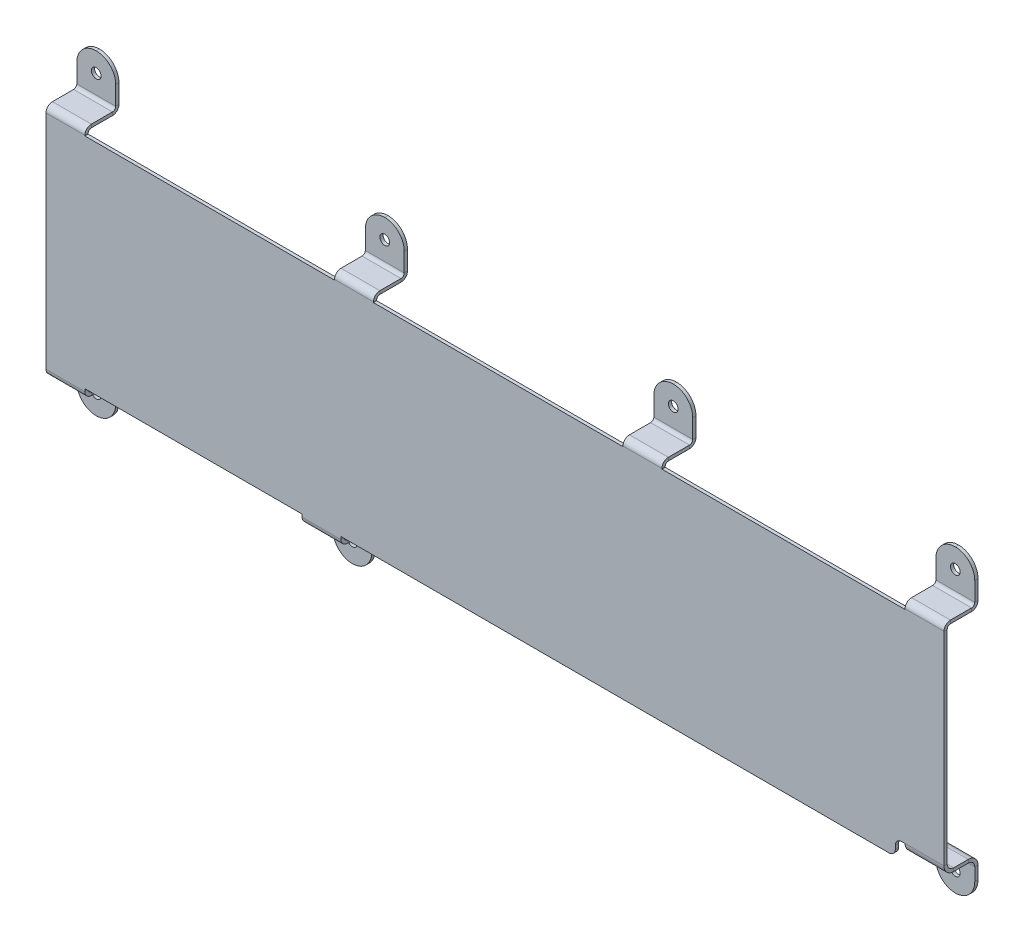
from build123d import *

# Parameters (mm, degrees)
SKETCH1_W          = 277
SKETCH1_H          = 97.5
BASE_FLANGE1_DEPTH = 1
JOG1_START         = -138.5
JOG1_DEPTH         = 277
JOG1_2_DEPTH       = 277
JOG2_START         = -138.5
JOG2_DEPTH         = 277
JOG2_2_DEPTH       = 277
SKETCH11_W         = 67
SKETCH11_H         = 15
SKETCH11_W_2       = 75
SKETCH11_W_3       = 77
CUT_EXTRUDE1_DEPTH = 148.204152455
SKETCH16_W         = 12
SKETCH16_H         = 22.35
TAB1_DEPTH         = 1
JOG4_START         = 126.5
JOG4_DEPTH         = 12
JOG4_2_DEPTH       = 12
SKETCH22_R         = 1.5
SCREW_HOLES_DEPTH  = 148.204152455
FILLET1_R          = 6
FILLET2_R          = 2


# Read off the part's stored shape, not the designer's step: Jog1, Jog2, Jog4
# Sheet-metal steps are written as plain solids
with BuildPart() as part:
    # Sketch1 → Base-Flange1 (new body)
    with BuildSketch(Plane.XY):
        Rectangle(SKETCH1_W, SKETCH1_H)
    extrude(amount=-BASE_FLANGE1_DEPTH)

    # Jog1 outline → Jog1 (cut)
    with BuildSketch(Plane.YZ.offset(JOG1_START)):
        with BuildLine():
            ThreePointArc((36.928097245, -1), (35.928097245, -0.732050807), (35.196046438, 0))
            Line((35.196046438, 0), (-48.75, 0))
            Line((-48.75, 0), (-48.75, -1))
            Line((-48.75, -1), (36.928097245, -1))
        make_face()
    extrude(amount=JOG1_DEPTH, mode=Mode.SUBTRACT)

    # Jog1 2 outline → Jog1 2 (add)
    with BuildSketch(Plane.YZ.offset(JOG1_START)):
        with BuildLine():
            Line((34.928097245, 7.5), (34.928097245, 1))
            ThreePointArc((34.928097245, 1), (34.996245593, 0.48236191), (35.196046438, 0))
            Line((35.196046438, 0), (36.928097245, 0))
            ThreePointArc((36.928097245, 0), (36.220990464, 0.292893219), (35.928097245, 1))
            Line((35.928097245, 1), (35.928097245, 7.5))
            ThreePointArc((35.928097245, 7.5), (35.342310807, 8.914213562), (33.928097245, 9.5))
            Line((33.928097245, 9.5), (-48.75, 9.5))
            Line((-48.75, 9.5), (-48.75, 8.5))
            Line((-48.75, 8.5), (33.928097245, 8.5))
            ThreePointArc((33.928097245, 8.5), (34.635204026, 8.207106781), (34.928097245, 7.5))
        make_face()
    extrude(amount=JOG1_2_DEPTH)

    # Jog2 outline → Jog2 (cut)
    with BuildSketch(Plane.YZ.offset(JOG2_START)):
        with BuildLine():
            Line((-48.75, 8.5), (-36.303953562, 8.5))
            ThreePointArc((-36.303953562, 8.5), (-35.571902755, 9.232050807), (-34.571902755, 9.5))
            Line((-34.571902755, 9.5), (-48.75, 9.5))
            Line((-48.75, 9.5), (-48.75, 8.5))
        make_face()
    extrude(amount=JOG2_DEPTH, mode=Mode.SUBTRACT)

    # Jog2 2 outline → Jog2 2 (add)
    with BuildSketch(Plane.YZ.offset(JOG2_START)):
        with BuildLine():
            Line((-48.75, -1), (-37.571902755, -1))
            ThreePointArc((-37.571902755, -1), (-36.157689193, -0.414213562), (-35.571902755, 1))
            Line((-35.571902755, 1), (-35.571902755, 7.5))
            ThreePointArc((-35.571902755, 7.5), (-35.279009536, 8.207106781), (-34.571902755, 8.5))
            Line((-34.571902755, 8.5), (-36.303953562, 8.5))
            ThreePointArc((-36.303953562, 8.5), (-36.503754407, 8.01763809), (-36.571902755, 7.5))
            Line((-36.571902755, 7.5), (-36.571902755, 1))
            ThreePointArc((-36.571902755, 1), (-36.864795974, 0.292893219), (-37.571902755, 0))
            Line((-37.571902755, 0), (-48.75, 0))
            Line((-48.75, 0), (-48.75, -1))
        make_face()
    extrude(amount=JOG2_2_DEPTH)

    # Sketch11 → Cut-Extrude1 (cut, through all)
    with BuildSketch(Plane(origin=(0, 0, -1), x_dir=(-1, 0, 0), z_dir=(0, 0, -1))):
        Polygon((-138.5, -48.75), (-123.5, -48.75), (-111.5, -48.75), (47.5, -48.75), (47.5, -33.75), (-111.5, -33.75), (-123.5, -33.75), (-123.5, -28.75), (-138.5, -28.75), align=None)
        with Locations((93, -41.25)):
            Rectangle(SKETCH11_W, SKETCH11_H)
        with Locations((-89, 41.25)):
            Rectangle(SKETCH11_W_2, SKETCH11_H)
        with Locations((-1, 41.25)):
            Rectangle(SKETCH11_W_3, SKETCH11_H)
        with Locations((88, 41.25)):
            Rectangle(SKETCH11_W_3, SKETCH11_H)
    extrude(amount=-CUT_EXTRUDE1_DEPTH, mode=Mode.SUBTRACT)

    # Sketch16 → Tab1 (add)
    with BuildSketch(Plane(origin=(0, 0, 8.5), x_dir=(-1, 0, 0), z_dir=(0, 0, -1))):
        with Locations((-132.5, -39.925)):
            Rectangle(SKETCH16_W, SKETCH16_H)
    extrude(amount=-TAB1_DEPTH)

    # Jog4 outline → Jog4 (cut)
    with BuildSketch(Plane.YZ.offset(JOG4_START)):
        with BuildLine():
            Line((-51.1, 8.5), (-30.986067978, 8.5))
            ThreePointArc((-30.986067978, 8.5), (-29.974744872, 9.238612788), (-28.75, 9.5))
            Line((-28.75, 9.5), (-51.1, 9.5))
            Line((-51.1, 9.5), (-51.1, 8.5))
        make_face()
    extrude(amount=JOG4_DEPTH, mode=Mode.SUBTRACT)

    # Jog4 2 outline → Jog4 2 (add)
    with BuildSketch(Plane.YZ.offset(JOG4_START)):
        with BuildLine():
            Line((-43.746018366, -1), (-33.75, -1))
            ThreePointArc((-33.75, -1), (-31.628679656, -0.121320344), (-30.75, 2))
            Line((-30.75, 2), (-30.75, 6.5))
            ThreePointArc((-30.75, 6.5), (-30.164213562, 7.914213562), (-28.75, 8.5))
            Line((-28.75, 8.5), (-30.986067978, 8.5))
            ThreePointArc((-30.986067978, 8.5), (-31.552517077, 7.570466269), (-31.75, 6.5))
            Line((-31.75, 6.5), (-31.75, 2))
            ThreePointArc((-31.75, 2), (-32.335786438, 0.585786438), (-33.75, 0))
            Line((-33.75, 0), (-43.746018366, 0))
            Line((-43.746018366, 0), (-43.746018366, -1))
        make_face()
    extrude(amount=JOG4_2_DEPTH)

    # Sketch22 → SCREW HOLES (cut, through all)
    with BuildSketch(Plane(origin=(0, 0, -1), x_dir=(-1, 0, 0), z_dir=(0, 0, -1))):
        with Locations((132.5, 42.75)):
            Circle(SKETCH22_R)
        with Locations((132.5, -42.75)):
            Circle(SKETCH22_R)
        with Locations((43.5, 42.75)):
            Circle(SKETCH22_R)
        with Locations((53.5, -42.75)):
            Circle(SKETCH22_R)
        with Locations((-45.5, 42.75)):
            Circle(SKETCH22_R)
        with Locations((-132.5, 42.75)):
            Circle(SKETCH22_R)
        with Locations((-132.5, -37.75)):
            Circle(SKETCH22_R)
    extrude(amount=-SCREW_HOLES_DEPTH, mode=Mode.SUBTRACT)

    # Fillet1
    fillet1_edges = [part.edges().sort_by_distance(p)[0] for p in [
        (39.5, 48.75, -0.5),
        (51.5, 48.75, -0.5),
        (-49.5, 48.75, -0.5),
        (-37.5, 48.75, -0.5),
        (-126.5, 48.75, -0.5),
        (-138.5, 48.75, -0.5),
        (-138.5, -48.75, -0.5),
        (-126.5, -48.75, -0.5),
        (-47.5, -48.75, -0.5),
        (-59.5, -48.75, -0.5),
        (138.5, -43.746018366, -0.5),
        (126.5, -43.746018366, -0.5),
        (138.5, 48.75, -0.5),
        (126.5, 48.75, -0.5),
    ]]
    fillet(fillet1_edges, radius=FILLET1_R - 0.0001)  # a hair under: the kernel refuses the full size

    # Fillet2
    fillet2_edges = [part.edges().sort_by_distance(p)[0] for p in [
        (123.5, -28.75, 9),
        (123.5, -33.75, 9),
    ]]
    fillet(fillet2_edges, radius=FILLET2_R)


solid = part.part
